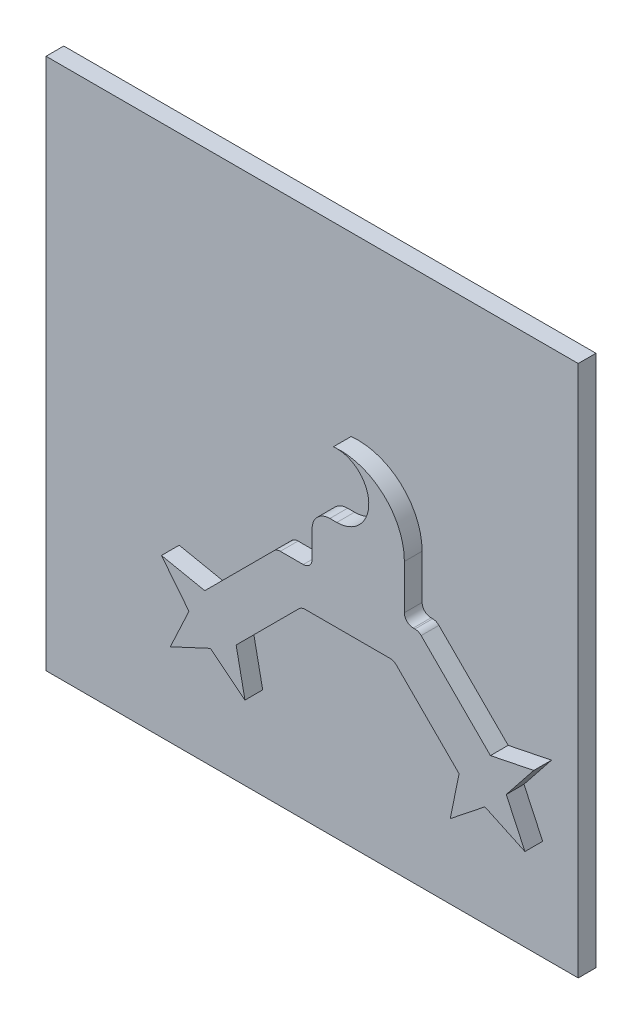
from build123d import *

# Parameters (mm, degrees)
SKICA1_W                = 300
SKICA1_H                = 300
P_IDAT_VYSUNUT_M1_DEPTH = 10
P_IDAT_VYSUNUT_M3_DEPTH = 10


with BuildPart() as part:
    # Skica1 → Přidat vysunutím1 (new body)
    with BuildSketch(Plane.XY):
        with Locations((150, 150)):
            Rectangle(SKICA1_W, SKICA1_H)
    extrude(amount=P_IDAT_VYSUNUT_M1_DEPTH)

    # Skica3 → Přidat vysunutím3 (add)
    with BuildSketch(Plane.XY.offset(10)):
        with BuildLine():
            Line((99.483495706, 93.838834765), (138.535533906, 132.890872965))
            ThreePointArc((138.535533906, 132.890872965), (140.15765065, 133.974736722), (142.071067812, 134.355339059))
            Line((142.071067812, 134.355339059), (155, 134.355339059))
            ThreePointArc((155, 134.355339059), (158.535533906, 135.819805153), (160, 139.355339059))
            Line((160, 139.355339059), (160, 154.355339059))
            ThreePointArc((160, 154.355339059), (162.928932188, 161.426406871), (170, 164.355339059))
            Line((170, 164.355339059), (173.894736842, 164.355339059))
            ThreePointArc((173.894736842, 164.355339059), (191.919650349, 183.353880213), (172, 200.355339059))
            ThreePointArc((172, 200.355339059), (200.016523285, 191.262587153), (212, 164.355339059))
            Line((212, 164.355339059), (212, 139.355339059))
            ThreePointArc((212, 139.355339059), (213.464466094, 135.819805153), (217, 134.355339059))
            Line((217, 134.355339059), (217.928932188, 134.355339059))
            ThreePointArc((217.928932188, 134.355339059), (219.84234935, 133.974736722), (221.464466094, 132.890872965))
            Line((221.464466094, 132.890872965), (260.516504294, 93.838834765))
            Line((260.516504294, 93.838834765), (284.938819925, 98.814580165))
            Line((284.938819925, 98.814580165), (269.42858824, 79.304576164))
            Line((269.42858824, 79.304576164), (279.961940777, 56.715728753))
            Line((279.961940777, 56.715728753), (257.373093366, 67.249081289))
            Line((257.373093366, 67.249081289), (237.863089365, 51.738849605))
            Line((237.863089365, 51.738849605), (242.838834765, 76.161165235))
            Line((242.838834765, 76.161165235), (207.464466094, 111.535533906))
            ThreePointArc((207.464466094, 111.535533906), (205.84234935, 112.619397663), (203.928932188, 113))
            Line((203.928932188, 113), (156.071067812, 113))
            ThreePointArc((156.071067812, 113), (154.15765065, 112.619397663), (152.535533906, 111.535533906))
            Line((152.535533906, 111.535533906), (117.161165235, 76.161165235))
            Line((117.161165235, 76.161165235), (122.136910635, 51.738849605))
            Line((122.136910635, 51.738849605), (102.626906634, 67.249081289))
            Line((102.626906634, 67.249081289), (80.038059223, 56.715728753))
            Line((80.038059223, 56.715728753), (90.57141176, 79.304576164))
            Line((90.57141176, 79.304576164), (75.061180075, 98.814580165))
            Line((75.061180075, 98.814580165), (99.483495706, 93.838834765))
        make_face()
    extrude(amount=P_IDAT_VYSUNUT_M3_DEPTH)


solid = part.part
